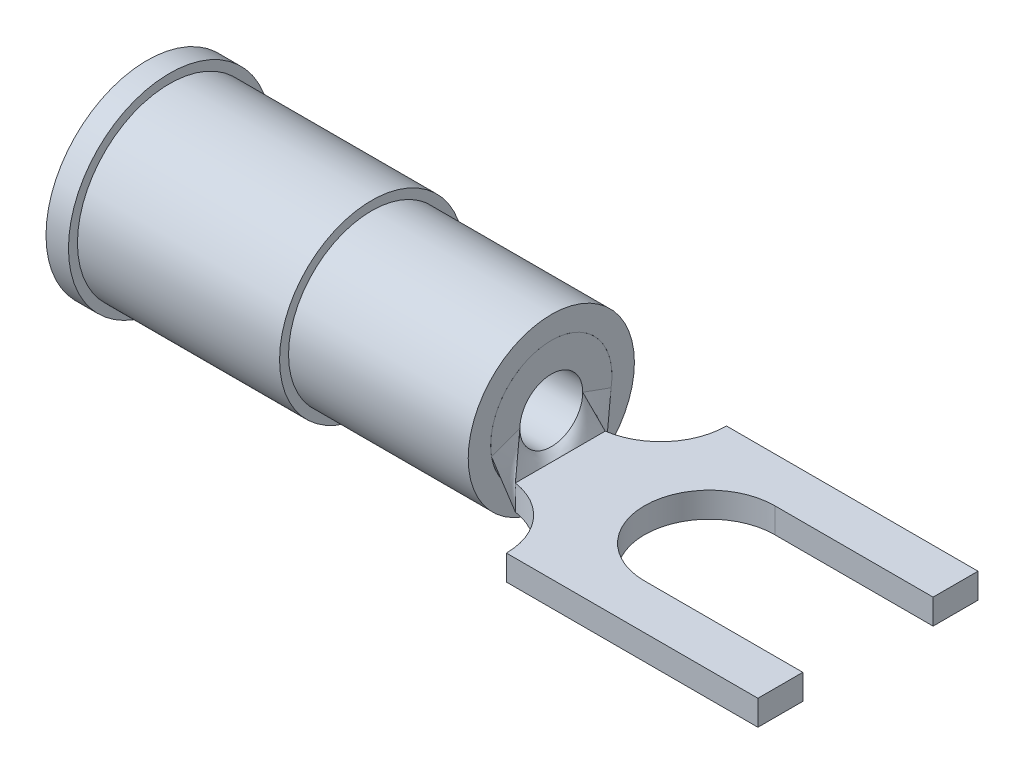
from build123d import *

# Parameters (mm, degrees)
EXTRUDE6_DEPTH = 0.7112
SKETCH11_R     = 1.7145
SKETCH11_R_2   = 0.889
EXTRUDE7_DEPTH = 5.08


with BuildPart() as part:
    # Sketch5 → Revolve1 (revolve)
    with BuildSketch(Plane.XY, mode=Mode.PRIVATE) as revolve1_sk:
        Polygon((0, 2.8575), (0.635, 2.8575), (0.635, 2.6035), (6.35, 2.6035), (6.35, 2.3495), (11.43, 2.3495), (11.43, 1.7145), (6.35, 1.7145), (6.35, 0.79375), (0.635, 1.8923), (0, 1.8923), align=None)
    revolve(revolve1_sk.sketch.rotate(Axis((0, 0, 0), (1, 0, 0)), 90), axis=Axis((0, 0, 0), (1, 0, 0)))


with BuildPart() as body_2:
    # Sketch7 → Extrude6 (new body)
    with BuildSketch(Plane(origin=(0, -1.016, 0), x_dir=(-1, 0, 0), z_dir=(0, 1, 0))):
        with BuildLine():
            Line((-13.2715, -3.1115), (-20.3835, -3.1115))
            Line((-20.3835, -3.1115), (-20.3835, -1.8415))
            Line((-20.3835, -1.8415), (-15.90675, -1.8415))
            ThreePointArc((-15.90675, -1.8415), (-14.06525, 0), (-15.90675, 1.8415))
            Line((-15.90675, 1.8415), (-20.3835, 1.8415))
            Line((-20.3835, 1.8415), (-20.3835, 3.1115))
            Line((-20.3835, 3.1115), (-13.2715, 3.1115))
            ThreePointArc((-13.2715, 3.1115), (-12.819841015, 1.895843953), (-11.684, 1.27))
            Line((-11.684, 1.27), (-11.684, -1.27))
            ThreePointArc((-11.684, -1.27), (-12.819841015, -1.895843953), (-13.2715, -3.1115))
        make_face()
    extrude(amount=-EXTRUDE6_DEPTH)


with BuildPart() as body_3:
    # Sketch11 → Extrude7 (new body)
    with BuildSketch(Plane(origin=(11.43, 0, 0), x_dir=(0, 0, -1), z_dir=(1, 0, 0))):
        Circle(SKETCH11_R)
        Circle(SKETCH11_R_2, mode=Mode.SUBTRACT)
    extrude(amount=-EXTRUDE7_DEPTH)


with BuildPart() as body_4:
    # Loft3: read off the stored shape, not the designer's step
    # Loft3: loft between two sections, ruled curve by curve
    loft3_from = [
        Edge.make_bspline([(11.43, -0.291379498, 1.689558593), (11.43, -0.430127833, 1.665630201), (11.43, -0.581040717, 1.622189064), (11.43, -0.891753825, 1.474408623), (11.43, -1.051676044, 1.369408232), (11.43, -1.344177572, 1.083738003), (11.43, -1.475965629, 0.902303445), (11.43, -1.661847679, 0.480508416), (11.43, -1.7145, 0.240688121), (11.43, -1.7145, -0.240688121), (11.43, -1.661847679, -0.480508416), (11.43, -1.475965629, -0.902303445), (11.43, -1.344177572, -1.083738003), (11.43, -1.051676044, -1.369408232), (11.43, -0.891753825, -1.474408623), (11.43, -0.581040717, -1.622189064), (11.43, -0.430127833, -1.665630201), (11.43, -0.291379498, -1.689558593)], [0, 0, 0, 0, 0.125, 0.125, 0.25, 0.25, 0.375, 0.375, 0.5, 0.5, 0.625, 0.625, 0.75, 0.75, 0.875, 0.875, 1, 1, 1, 1], 3),
        Edge.make_bspline([(11.43, -0.291379498, -1.689558593), (11.43, -0.242816249, -1.556132161), (11.43, -0.194252999, -1.422705728), (11.43, -0.097126499, -1.155852864), (11.43, -0.04856325, -1.022426432), (11.43, 0, -0.889)], [0, 0, 0, 0, 0.5, 0.5, 1, 1, 1, 1], 3),
        Edge.make_bspline([(11.43, 0, 0.889), (11.43, -0.04856325, 1.022426432), (11.43, -0.097126499, 1.155852864), (11.43, -0.194252999, 1.422705728), (11.43, -0.242816249, 1.556132161), (11.43, -0.291379498, 1.689558593)], [0, 0, 0, 0, 0.5, 0.5, 1, 1, 1, 1], 3),
        Edge.make_bspline([(11.43, 0, -0.889), (11.43, -0.074083333, -0.889), (11.43, -0.1578864, -0.879991467), (11.43, -0.3399536, -0.826888533), (11.43, -0.438573333, -0.78232), (11.43, -0.628226667, -0.64008), (11.43, -0.718787774, -0.541397924), (11.43, -0.850035755, -0.295307958), (11.43, -0.889, -0.148166667), (11.43, -0.889, 0.148166667), (11.43, -0.850035755, 0.295307958), (11.43, -0.718787774, 0.541397924), (11.43, -0.628226667, 0.64008), (11.43, -0.438573333, 0.78232), (11.43, -0.3399536, 0.826888533), (11.43, -0.1578864, 0.879991467), (11.43, -0.074083333, 0.889), (11.43, 0, 0.889)], [0, 0, 0, 0, 0.125, 0.125, 0.25, 0.25, 0.375, 0.375, 0.5, 0.5, 0.625, 0.625, 0.75, 0.75, 0.875, 0.875, 1, 1, 1, 1], 3),
    ]
    loft3_to = [
        Edge.make_bspline([(11.684, -1.7272, 1.27), (11.684, -1.7272, 1.164166667), (11.684, -1.7272, 1.058333333), (11.684, -1.7272, 0.846666667), (11.684, -1.7272, 0.740833333), (11.684, -1.7272, 0.529166667), (11.684, -1.7272, 0.423333333), (11.684, -1.7272, 0.211666667), (11.684, -1.7272, 0.105833333), (11.684, -1.7272, -0.105833333), (11.684, -1.7272, -0.211666667), (11.684, -1.7272, -0.423333333), (11.684, -1.7272, -0.529166667), (11.684, -1.7272, -0.740833333), (11.684, -1.7272, -0.846666667), (11.684, -1.7272, -1.058333333), (11.684, -1.7272, -1.164166667), (11.684, -1.7272, -1.27)], [0, 0, 0, 0, 0.125, 0.125, 0.25, 0.25, 0.375, 0.375, 0.5, 0.5, 0.625, 0.625, 0.75, 0.75, 0.875, 0.875, 1, 1, 1, 1], 3),
        Edge.make_bspline([(11.684, -1.7272, -1.27), (11.684, -1.608666667, -1.27), (11.684, -1.490133333, -1.27), (11.684, -1.253066667, -1.27), (11.684, -1.134533333, -1.27), (11.684, -1.016, -1.27)], [0, 0, 0, 0, 0.5, 0.5, 1, 1, 1, 1], 3),
        Edge.make_bspline([(11.684, -1.016, 1.27), (11.684, -1.134533333, 1.27), (11.684, -1.253066667, 1.27), (11.684, -1.490133333, 1.27), (11.684, -1.608666667, 1.27), (11.684, -1.7272, 1.27)], [0, 0, 0, 0, 0.5, 0.5, 1, 1, 1, 1], 3),
        Edge.make_bspline([(11.684, -1.016, -1.27), (11.684, -1.016, -1.164166667), (11.684, -1.016, -1.058333333), (11.684, -1.016, -0.846666667), (11.684, -1.016, -0.740833333), (11.684, -1.016, -0.529166667), (11.684, -1.016, -0.423333333), (11.684, -1.016, -0.211666667), (11.684, -1.016, -0.105833333), (11.684, -1.016, 0.105833333), (11.684, -1.016, 0.211666667), (11.684, -1.016, 0.423333333), (11.684, -1.016, 0.529166667), (11.684, -1.016, 0.740833333), (11.684, -1.016, 0.846666667), (11.684, -1.016, 1.058333333), (11.684, -1.016, 1.164166667), (11.684, -1.016, 1.27)], [0, 0, 0, 0, 0.125, 0.125, 0.25, 0.25, 0.375, 0.375, 0.5, 0.5, 0.625, 0.625, 0.75, 0.75, 0.875, 0.875, 1, 1, 1, 1], 3),
    ]
    loft3 = Solid(Shell([*[Face.make_surface_from_curves(loft3_from[k], loft3_to[k]) for k in range(4)], Face(Wire(loft3_from)), Face(Wire(loft3_to))]))
    add(loft3)


solid = Compound([part.part, body_2.part, body_3.part, body_4.part])
